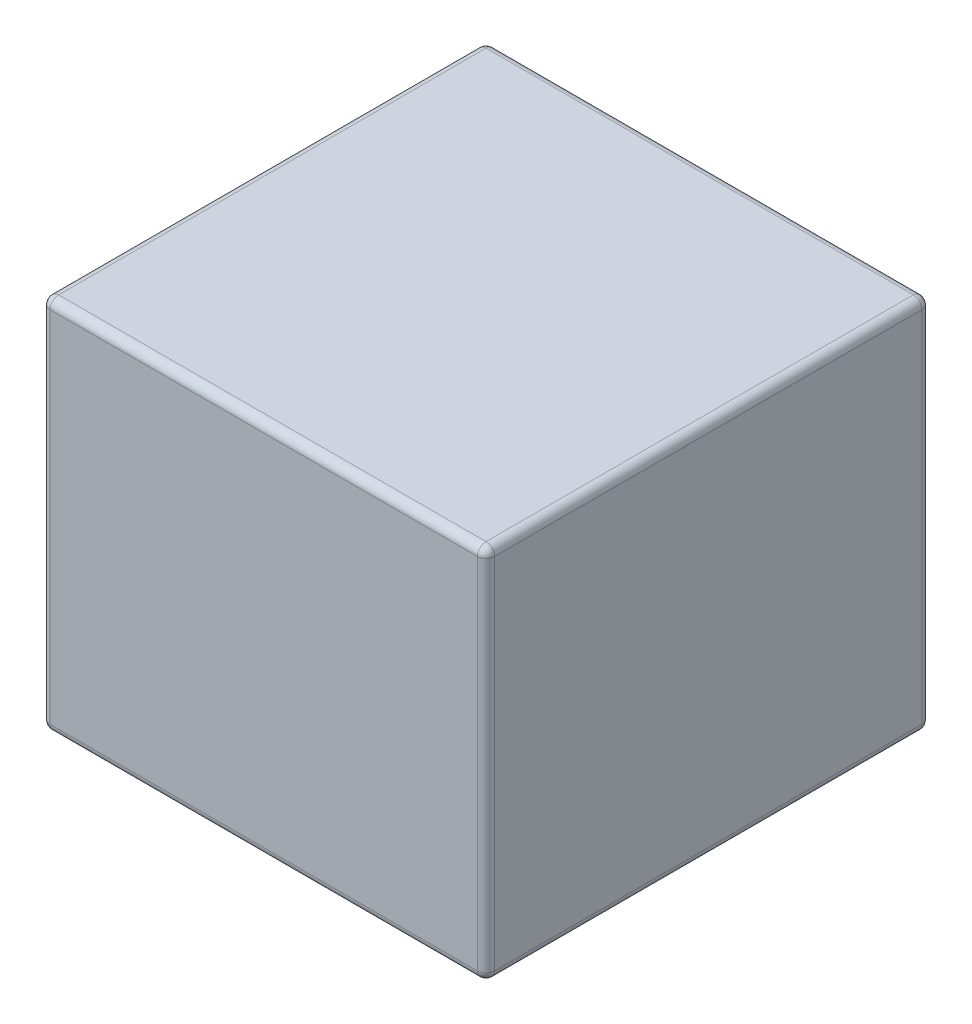
from build123d import *

# Parameters (mm, degrees)
SKETCH1_W           = 330.2
SKETCH1_H           = 330.2
BOSS_EXTRUDE1_DEPTH = 279.4
FILLET1_R           = 6.35


with BuildPart() as part:
    # Sketch1 → Boss-Extrude1 (new body)
    with BuildSketch(Plane(origin=(0, 0, 0), x_dir=(1, 0, 0), z_dir=(0, 1, 0))):
        with Locations((165.1, 165.1)):
            Rectangle(SKETCH1_W, SKETCH1_H)
    extrude(amount=BOSS_EXTRUDE1_DEPTH)

    # Fillet1
    fillet1_edges = [part.edges().sort_by_distance(p)[0] for p in [
        (0, 0, -165.1),
        (0, 139.7, -330.2),
        (165.1, 0, -330.2),
        (330.2, 139.7, -330.2),
        (330.2, 0, -165.1),
        (0, 139.7, 0),
        (330.2, 139.7, 0),
        (165.1, 0, 0),
        (165.1, 279.4, -330.2),
        (330.2, 279.4, -165.1),
        (165.1, 279.4, 0),
        (0, 279.4, -165.1),
    ]]
    fillet(fillet1_edges, radius=FILLET1_R)


solid = part.part
